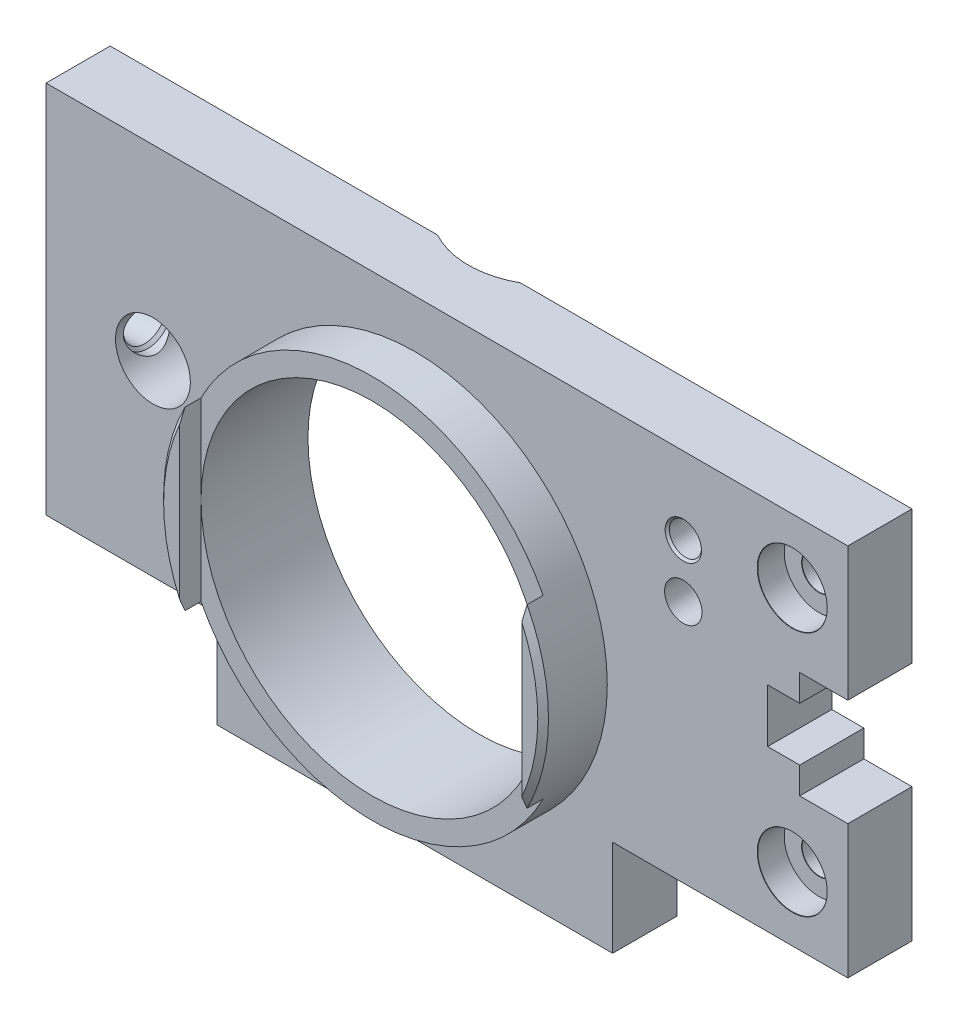
from build123d import *

# Parameters (mm, degrees)
SKETCH_1_R                  = 16
EXTRUDE_1_DEPTH             = 12
SKETCH_3_R                  = 18
CUT_EXTRUDE_2_DEPTH         = 6
CUT_EXTRUDE_5_DEPTH         = 2
CUT_EXTRUDE_6_REACH         = 62.994
CUT_EXTRUDE_6_END_RADIUS    = 16
HOLE_WIZARD_M3_AT_2_COUNT   = 2
HOLE_WIZARD_M3_AT_2_PITCH   = 23
HOLE_WIZARD_M3_1_AT_2_COUNT = 2
HOLE_WIZARD_M3_1_AT_2_PITCH = 26
SKETCH_11_R                 = 3.5
CUT_EXTRUDE_8_DEPTH         = 47.717234568
SKETCH_12_W                 = 3
SKETCH_12_H                 = 5
CUT_EXTRUDE_9_DEPTH         = 47.717234568
SKETCH_15_R                 = 1.75
CUT_EXTRUDE_10_DEPTH        = 47.717234568
CHAMFER_1_SIZE              = 0.5


# Read off the part's stored shape, not the designer's step: M4
with BuildPart() as part:
    # Эскиз1 → Бобышка-Вытянуть1 (new body)
    with BuildSketch(Plane.XY):
        Polygon((-34.5, 22.5), (12.5, 22.5), (40.5, 22.5), (40.5, -12.5), (18.5, -12.5), (18.5, -21.5), (-18.5, -21.5), (-18.5, -12.5), (-34.5, -12.5), align=None)
        Circle(SKETCH_1_R, mode=Mode.SUBTRACT)
    extrude(amount=EXTRUDE_1_DEPTH)

    # Эскиз3 → Вырез-Вытянуть2 (cut)
    with BuildSketch(Plane.XY.offset(12)):
        Polygon((18.5, -21.5), (18.5, -12.5), (40.5, -12.5), (40.5, 22.5), (-34.5, 22.5), (-34.5, -12.5), (-18.5, -12.5), (-18.5, -21.5), align=None)
        Circle(SKETCH_3_R, mode=Mode.SUBTRACT)
    extrude(amount=-CUT_EXTRUDE_2_DEPTH, mode=Mode.SUBTRACT)

    # Эскиз4 → Вырез-Вытянуть5 (cut)
    with BuildSketch(Plane.XY.offset(12)):
        with BuildLine():
            ThreePointArc((16, 8.246211251), (0, 18), (-16, 8.246211251))
            Line((-16, 8.246211251), (-16, 8.8e-08))
            ThreePointArc((-16, 8.8e-08), (4.4e-08, 16), (16, 0))
            Line((16, 0), (16, 8.246211251))
        make_face()
        with BuildLine():
            ThreePointArc((16, 0), (-4.4e-08, -16), (-16, 8.8e-08))
            Line((-16, 8.8e-08), (-16, -8.246211251))
            ThreePointArc((-16, -8.246211251), (0, -18), (16, -8.246211251))
            Line((16, -8.246211251), (16, 0))
        make_face()
    extrude(amount=-CUT_EXTRUDE_5_DEPTH, mode=Mode.SUBTRACT)

    # Вырез-Вытянуть6: up to this cylinder (the profile starts outside it)
    cut_extrude_6_end = Plane(origin=(0, 0, 0.402223), z_dir=(0, 0, -1)) * Cylinder(CUT_EXTRUDE_6_END_RADIUS, 158.988, mode=Mode.PRIVATE)
    # Эскиз5 → Вырез-Вытянуть6 (cut, up to the surface)
    with BuildSketch(Plane(origin=(0, 22.5, 0), x_dir=(1, 0, 0), z_dir=(0, 1, 0)), mode=Mode.PRIVATE) as cut_extrude_6_sk1:
        with BuildLine():
            Line((-3.872983346, 0), (3.872983346, 0))
            ThreePointArc((3.872983346, 0), (0, -1), (-3.872983346, 0))
        make_face()
    cut_extrude_6_tool1 = extrude(cut_extrude_6_sk1.sketch, amount=-CUT_EXTRUDE_6_REACH, mode=Mode.PRIVATE) - cut_extrude_6_end
    add(cut_extrude_6_tool1.solids().sort_by_distance((0, 22.5, 0.402223))[0], mode=Mode.SUBTRACT)

    # Эскиз7 → Цековка для  M3 (revolve, cut)
    with BuildSketch(Plane(origin=(35.3, 16.5, 6), x_dir=(0, -1, 0), z_dir=(1, 0, 0))):
        Polygon((0, 0), (0, 6), (1.625, 6), (1.6, 5.975), (1.6, 2.525), (1.625, 2.5), (3.25, 2.5), (3.25, 0.025), (3.275, 0), align=None)
    hole_wizard_m3 = revolve(axis=Axis((35.3, 16.5, 12.35), (0, 0, -1)), mode=Mode.SUBTRACT)

    # Цековка для  M3 at 2: Цековка для  M3 ×2
    with Locations(*[(0, -i * HOLE_WIZARD_M3_AT_2_PITCH, 0) for i in range(1, HOLE_WIZARD_M3_AT_2_COUNT)]):
        add(hole_wizard_m3, mode=Mode.SUBTRACT)

    # Эскиз9 → M3_1 (revolve, cut)
    with BuildSketch(Plane(origin=(-34.5, -8, 3), x_dir=(0, 0, 1), z_dir=(0, 1, 0))):
        Polygon((0, 0), (0, 12.251075774), (1.25, 11.5), (1.25, 9), (1.5, 9), (1.5, 0.1), (1.6, 0), align=None)
    hole_wizard_m3_1 = revolve(axis=Axis((-40.85, -8, 3), (1, 0, 0)), mode=Mode.SUBTRACT)

    # M3_1 at 2: M3_1 ×2
    with Locations(*[(0, i * HOLE_WIZARD_M3_1_AT_2_PITCH, 0) for i in range(1, HOLE_WIZARD_M3_1_AT_2_COUNT)]):
        add(hole_wizard_m3_1, mode=Mode.SUBTRACT)

    # Эскиз11 → Вырез-Вытянуть8 (cut, through all)
    with BuildSketch(Plane.XY.offset(6)):
        with Locations((-24.5, 5)):
            Circle(SKETCH_11_R)
    extrude(amount=-CUT_EXTRUDE_8_DEPTH, mode=Mode.SUBTRACT)

    # Эскиз12 → Вырез-Вытянуть9 (cut, through all)
    with BuildSketch(Plane.XY.offset(6)):
        Polygon((40.5, 0), (40.5, 10), (36, 10), (36, 7.5), (36, 2.5), (36, 0), align=None)
        with Locations((34.5, 5)):
            Rectangle(SKETCH_12_W, SKETCH_12_H)
    extrude(amount=-CUT_EXTRUDE_9_DEPTH, mode=Mode.SUBTRACT)

    # M4 outline → M4 (revolve, cut)
    with BuildSketch(Plane(origin=(0, 5, 3), x_dir=(0, 1, 0), z_dir=(0, 0, -1))):
        Polygon((2.275, -28), (2.275, -27.159503456), (0, -27.159503456), (0, -34.5), (2.275, -34.5), (2, -34.225), (2, -28.275), align=None)
    revolve(axis=Axis((0, 5, 3), (1, 0, 0)), mode=Mode.SUBTRACT)

    # Эскиз15 → Вырез-Вытянуть10 (cut, through all)
    with BuildSketch(Plane.XY.offset(6)):
        with Locations((25.11, 10.285533906)):
            Circle(SKETCH_15_R)
    extrude(amount=-CUT_EXTRUDE_10_DEPTH, mode=Mode.SUBTRACT)

    # Эскиз16 → M3_2 (revolve, cut)
    with BuildSketch(Plane(origin=(25.11, 15.285533906, 6), x_dir=(0, -1, 0), z_dir=(1, 0, 0))):
        Polygon((0, 0), (0, 6), (1.7, 6), (1.5, 5.8), (1.5, 0.2), (1.7, 0), align=None)
    revolve(axis=Axis((25.11, 15.285533906, 12.35), (0, 0, -1)), mode=Mode.SUBTRACT)

    # Фаска1
    chamfer_1_edges = [part.edges().sort_by_distance(p)[0] for p in [
        (-18, 0, 12),
        (17.492855685, -4.242640687, 12),
    ]]
    chamfer(chamfer_1_edges, length=CHAMFER_1_SIZE)


solid = part.part
